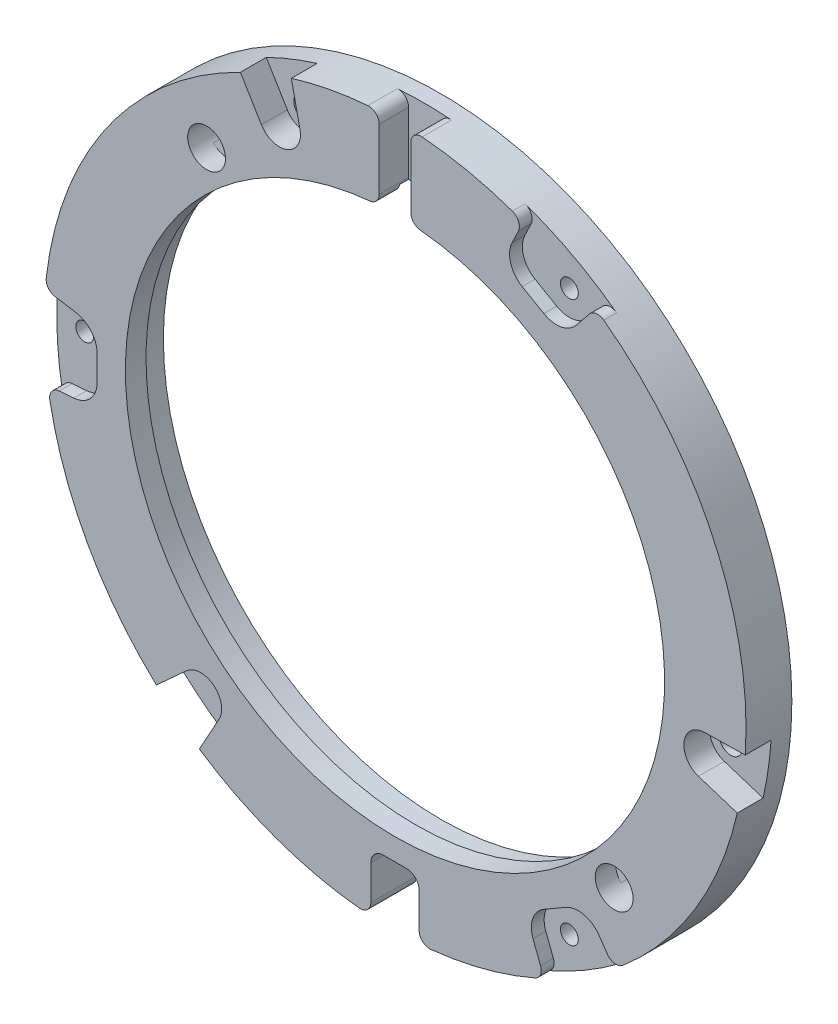
from build123d import *
from build123d.topology import SkipClean

# Parameters (mm, degrees)
CUT_EXTRUDE_1_DEPTH              = 3
SKETCH_3_R                       = 0.425
CUT_EXTRUDE_2_DEPTH              = 10
CUT_EXTRUDE_3_DEPTH              = 0.61
FILLET_1_R                       = 0.5
PATTERN_CIRCULAR_1_COUNT         = 3
FILLET_1_OF_PATTERN_CIRCULAR_1_R = 0.5
SKETCH_5_W                       = 1.5
SKETCH_5_H                       = 10.413141387
CUT_EXTRUDE_4_DEPTH              = 1.4
FILLET_2_R                       = 0.6
SKETCH_22_R                      = 0.9
CUT_EXTRUDE_14_DEPTH             = 24.697731959
FILLET_3_R                       = 0.5
SKETCH_14_R                      = 0.55
CUT_EXTRUDE_9_DEPTH              = 24.697731959
CUT_EXTRUDE_10_DEPTH             = 1.23
SKETCH_23_R                      = 13.2
SKETCH_23_R_2                    = 0.425
SKETCH_23_R_3                    = 0.9
SKETCH_23_R_4                    = 0.55
EXTRUDE_1_DEPTH                  = 0.23
CUT_EXTRUDE_15_DEPTH             = 1.2


with BuildPart() as part:
    # Эскиз1 → Повернуть1 (revolve)
    with BuildSketch(Plane(origin=(0, 0, 0), x_dir=(1, 0, 0), z_dir=(0, 1, 0)), mode=Mode.PRIVATE) as revolve_1_sk:
        Polygon((-16.7, 0), (-12.825, 0), (-12.825, 0.98), (-13.2, 0.98), (-13.2, 1.95), (-16.7, 1.95), align=None)
    revolve(revolve_1_sk.sketch.rotate(Axis((0, 0, 0), (0, 0, -1)), 180), axis=Axis((0, 0, 0), (0, 0, -1)))

    # Эскиз2 → Вырез-Вытянуть1 (cut)
    with BuildSketch(Plane(origin=(0, 0, -1.95), x_dir=(-1, 0, 0), z_dir=(0, 0, -1))):
        with BuildLine():
            Line((1.15, -16.660357139), (1.15, -13.86))
            Line((1.15, -13.86), (-1.15, -13.86))
            Line((-1.15, -13.86), (-1.15, -16.660357139))
            ThreePointArc((-1.15, -16.660357139), (0, -16.850858655), (1.15, -16.660357139))
        make_face()
    extrude(amount=-CUT_EXTRUDE_1_DEPTH, mode=Mode.SUBTRACT)

    # Эскиз3 → Вырез-Вытянуть2 (cut)
    with BuildSketch(Plane.XY):
        with Locations((-15.37, 0)):
            Circle(SKETCH_3_R)
    cut_extrude_2 = extrude(amount=-CUT_EXTRUDE_2_DEPTH, mode=Mode.SUBTRACT)

    # Эскиз4 → Вырез-Вытянуть3 (cut)
    with BuildSketch(Plane.XY):
        with BuildLine():
            Line((-15.183288241, 1.185390734), (-17.344587168, 1.525820031))
            Line((-17.344587168, 1.525820031), (-17.293113612, -0.525872079))
            Line((-17.293113612, -0.525872079), (-16.759364893, -2.507589098))
            Line((-16.759364893, -2.507589098), (-15.275238911, -2.391362418))
            ThreePointArc((-15.275238911, -2.391362418), (-14.487532806, -2.009361072), (-14.168928398, -1.193948803))
            Line((-14.168928398, -1.193948803), (-14.170000491, 0.001081813))
            ThreePointArc((-14.170000491, 0.001081813), (-14.458194682, 0.780140539), (-15.183288241, 1.185390734))
        make_face()
    cut_extrude_3 = extrude(amount=-CUT_EXTRUDE_3_DEPTH, mode=Mode.SUBTRACT)

    # Скругление1
    fillet_1_edges = [part.edges().sort_by_distance(p)[0] for p in [
        (-16.513575068, -2.488340506, -0.305),
        (-16.639959355, 1.414833093, -0.305),
    ]]
    fillet(fillet_1_edges, radius=FILLET_1_R)

    # Круговой массив1: Вырез-Вытянуть2, Вырез-Вытянуть3 ×3 about axis
    pattern_circular_1_axis = Axis((0, 0, 0), (0, 0, 1))
    add([cut_extrude_2.rotate(pattern_circular_1_axis, i * 360 / PATTERN_CIRCULAR_1_COUNT) for i in range(1, PATTERN_CIRCULAR_1_COUNT)], mode=Mode.SUBTRACT)
    add([cut_extrude_3.rotate(pattern_circular_1_axis, i * 360 / PATTERN_CIRCULAR_1_COUNT) for i in range(1, PATTERN_CIRCULAR_1_COUNT)], mode=Mode.SUBTRACT)

    # Скругление1 of Круговой массив1
    fillet_1_of_pattern_circular_1_edges = [part.edges().sort_by_distance(p)[0] for p in [
        (10.411753626, -13.057005263, -0.305),
        (7.094698277, -15.118044065, -0.305),
        (6.101821442, 15.545345769, -0.305),
        (9.545261078, 13.703210973, -0.305),
    ]]
    fillet(fillet_1_of_pattern_circular_1_edges, radius=FILLET_1_OF_PATTERN_CIRCULAR_1_R)

    # Эскиз5 → Вырез-Вытянуть4 (cut)
    with BuildSketch(Plane.XY):
        with Locations((0, 14.598970831)):
            Rectangle(SKETCH_5_W, SKETCH_5_H)
    extrude(amount=-CUT_EXTRUDE_4_DEPTH, mode=Mode.SUBTRACT)

    # Скругление2
    fillet_2_edges = [part.edges().sort_by_distance(p)[0] for p in [
        (1.15, -13.86, -0.975),
        (-1.15, -13.86, -0.975),
    ]]
    fillet(fillet_2_edges, radius=FILLET_2_R)

    # Эскиз22 → Вырез-Вытянуть14 (cut, through all)
    with BuildSketch(Plane(origin=(0, 0, -1.95), x_dir=(-1, 0, 0), z_dir=(0, 0, -1))):
        with Locations((-10.425450224, -9.714550304)):
            Circle(SKETCH_22_R)
        with Locations((8.963643503, 11.077707125)):
            Circle(SKETCH_22_R)
    extrude(amount=-CUT_EXTRUDE_14_DEPTH, mode=Mode.SUBTRACT)

    # Скругление3
    # the kernel refuses this fillet: 0.5 mm, written as the material it takes off along each edge
    with BuildSketch(Plane(origin=(-0.75, 12.803051394, 1.157971634), x_dir=(0, 1, 0), z_dir=(0, 0, -1))) as fillet_3_piece_1_section:
        with BuildLine():
            CenterArc((0.463188653, -0.5), FILLET_3_R, 90, 84.617246865)
            ThreePointArc((-0.03460647, -0.453095685), (-0.015296317, -0.226701126), (0, 0))
            Line((0, 0), (0.463188653, 0))
        make_face()
    fillet_3_piece_1 = extrude(amount=3.295943267, mode=Mode.PRIVATE)
    fillet_3_piece_1 = split(fillet_3_piece_1, bisect_by=Plane(origin=(-0.752336833, 13.200365704, -1.4), z_dir=(0, 0, 1)), keep=Keep.TOP, mode=Mode.PRIVATE)
    add(fillet_3_piece_1, mode=Mode.SUBTRACT)
    with BuildSketch(Plane(origin=(0.75, 12.803051394, 1.157971634), x_dir=(0.9970959124373047, -0.07615603325291273, 0), z_dir=(0, 0, -1))) as fillet_3_piece_2_section:
        with BuildLine():
            CenterArc((0.463273346, -0.49992153), FILLET_3_R, 91.015105015, 84.617246865)
            Line((-0.03527461, -0.461843513), (0, 0))
            ThreePointArc((0, 0), (0.227207673, -0.002012763), (0.454415347, 0))
        make_face()
    fillet_3_piece_2 = extrude(amount=3.295943267, mode=Mode.PRIVATE)
    fillet_3_piece_2 = split(fillet_3_piece_2, bisect_by=Plane(origin=(0.850744081, 12.897606018, -1.4), z_dir=(0, 0, 1)), keep=Keep.TOP, mode=Mode.PRIVATE)
    add(fillet_3_piece_2, mode=Mode.SUBTRACT)
    with BuildSketch(Plane(origin=(0.75, 16.683150182, -1.4), x_dir=(0.9981351186761567, -0.061043303198095235, 0), z_dir=(0, 0, 1))) as fillet_3_piece_3:
        with BuildLine():
            CenterArc((0.531508869, -0.499934747), FILLET_3_R, 89.074330097, 94.425369323)
            Line((0.03244131, -0.530456399), (0, 0))
            ThreePointArc((0, 0), (0.269793256, 0.002179436), (0.539586512, 0))
        make_face()
    extrude(amount=2.748966279, mode=Mode.SUBTRACT)
    with BuildSketch(Plane(origin=(-0.75, 16.683150182, -1.4), x_dir=(-0.9981351186761567, -0.06104330319809576, 0), z_dir=(0, 0, 1))) as fillet_3_piece_4:
        with BuildLine():
            CenterArc((0.531508869, 0.499934747), FILLET_3_R, 176.500300581, 94.425369323)
            Line((0.03244131, 0.530456399), (0, 0))
            ThreePointArc((0, 0), (0.269793256, -0.002179436), (0.539586512, 0))
        make_face()
    extrude(amount=2.748966279, mode=Mode.SUBTRACT)
    with BuildSketch(Plane(origin=(-1.15, -16.660357139, -3.33236123), x_dir=(-0.9963494237820577, 0.08536876319334569, 0), z_dir=(0, 0, 1))) as fillet_3_piece_5:
        with BuildLine():
            CenterArc((0.54466688, -0.499931476), FILLET_3_R, 89.051412184, 95.845818339)
            Line((0.046492168, -0.542615858), (0, 0))
            ThreePointArc((0, 0), (0.276472246, 0.002288687), (0.552944492, 0))
        make_face()
    extrude(amount=4.71472246, mode=Mode.SUBTRACT)
    with BuildSketch(Plane(origin=(1.15, -16.660357139, -3.33236123), x_dir=(0, 1, 0), z_dir=(0, 0, 1))) as fillet_3_piece_6:
        with BuildLine():
            CenterArc((0.544603976, -0.5), FILLET_3_R, 90, 95.845818339)
            ThreePointArc((0.047204187, -0.550925926), (0.021321762, -0.275658345), (0, 0))
            Line((0, 0), (0.544603976, 0))
        make_face()
    extrude(amount=4.71472246, mode=Mode.SUBTRACT)

    # Эскиз14 → Вырез-Вытянуть9 (cut, through all)
    with BuildSketch(Plane.XY):
        with Locations((-5.497143352, 13.848877751)):
            Circle(SKETCH_14_R)
        with Locations((-9.24490827, -11.685104667)):
            Circle(SKETCH_14_R)
        with Locations((14.742051622, -2.163773084)):
            Circle(SKETCH_14_R)
    extrude(amount=-CUT_EXTRUDE_9_DEPTH, mode=Mode.SUBTRACT)

    # Эскиз15 → Вырез-Вытянуть10 (cut)
    with BuildSketch(Plane.XY):
        with BuildLine():
            Line((-7.888402349, 15.883675138), (-5.15235159, 16.969717163))
            Line((-5.15235159, 16.969717163), (-4.519975471, 14.06134641))
            ThreePointArc((-4.519975471, 14.06134641), (-5.128207557, 12.919422868), (-6.354014422, 13.333346986))
            Line((-6.354014422, 13.333346986), (-7.888402349, 15.883675138))
        make_face()
        with BuildLine():
            Line((17.699867349, -1.110280739), (17.272381953, -4.022791215))
            Line((17.272381953, -4.022791215), (14.437470938, -3.116259623))
            ThreePointArc((14.437470938, -3.116259623), (13.752652185, -2.018553414), (14.724024418, -1.163935587))
            Line((14.724024418, -1.163935587), (17.699867349, -1.110280739))
        make_face()
        with BuildLine():
            Line((-9.811465, -14.773394399), (-12.120030363, -12.946925948))
            Line((-12.120030363, -12.946925948), (-9.917495467, -10.945086787))
            ThreePointArc((-9.917495467, -10.945086787), (-8.624444628, -10.900869454), (-8.370009996, -12.169411398))
            Line((-8.370009996, -12.169411398), (-9.811465, -14.773394399))
        make_face()
    extrude(amount=-CUT_EXTRUDE_10_DEPTH, mode=Mode.SUBTRACT)

    # Эскиз23 → Бобышка-Вытянуть1 (add)
    with SkipClean():  # the faces are left unmerged after this step: merging them gives an invalid solid
        with BuildSketch(Plane(origin=(0, 0, -1.95), x_dir=(-1, 0, 0), z_dir=(0, 0, -1))):
            with BuildLine():
                Line((1.15, -14.46), (1.15, -16.115753163))
                ThreePointArc((1.15, -16.115753163), (1.314935053, -16.486875085), (1.700925926, -16.613152952))
                ThreePointArc((1.700925926, -16.613152952), (0, 16.7), (-1.700925926, -16.613152952))
                ThreePointArc((-1.700925926, -16.613152952), (-1.314935053, -16.486875085), (-1.15, -16.115753163))
                Line((-1.15, -16.115753163), (-1.15, -14.46))
                ThreePointArc((-1.15, -14.46), (-0.974264069, -14.035735931), (-0.55, -13.86))
                Line((-0.55, -13.86), (0.55, -13.86))
                ThreePointArc((0.55, -13.86), (0.974264069, -14.035735931), (1.15, -14.46))
            make_face()
            with Locations(Location((0, 0, 0), (0, 0, 93.291137806))):
                Circle(SKETCH_23_R, mode=Mode.SUBTRACT)
            with Locations(Location((15.37, 0, 0), (0, 0, 180))):
                Circle(SKETCH_23_R_2, mode=Mode.SUBTRACT)
            with Locations(Location((-7.685, -13.310810456, 0), (0, 0, 180))):
                Circle(SKETCH_23_R_2, mode=Mode.SUBTRACT)
            with Locations(Location((-7.685, 13.310810456, 0), (0, 0, 180))):
                Circle(SKETCH_23_R_2, mode=Mode.SUBTRACT)
            with Locations((8.963643503, 11.077707125)):
                Circle(SKETCH_23_R_3, mode=Mode.SUBTRACT)
            with Locations((-10.425450224, -9.714550304)):
                Circle(SKETCH_23_R_3, mode=Mode.SUBTRACT)
            with Locations(Location((-14.742051622, -2.163773084, 0), (0, 0, 180))):
                Circle(SKETCH_23_R_4, mode=Mode.SUBTRACT)
            with Locations(Location((9.24490827, -11.685104667, 0), (0, 0, 180))):
                Circle(SKETCH_23_R_4, mode=Mode.SUBTRACT)
            with Locations(Location((5.497143352, 13.848877751, 0), (0, 0, 180))):
                Circle(SKETCH_23_R_4, mode=Mode.SUBTRACT)
        extrude(amount=EXTRUDE_1_DEPTH)

    # Эскиз24 → Вырез-Вытянуть15 (cut)
    with SkipClean():  # the faces are left unmerged after this step: merging them gives an invalid solid
        with BuildSketch(Plane(origin=(0, 0, -2.18), x_dir=(-1, 0, 0), z_dir=(0, 0, -1))):
            with BuildLine():
                Line((-9.767231893, -10.328348828), (9.621861835, 10.463908601))
                ThreePointArc((9.621861835, 10.463908601), (9.577442027, 11.735925456), (8.305425172, 11.691505649))
                Line((8.305425172, 11.691505649), (-11.083668556, -9.10075178))
                ThreePointArc((-11.083668556, -9.10075178), (-11.039248749, -10.372768636), (-9.767231893, -10.328348828))
            make_face()
        extrude(amount=-CUT_EXTRUDE_15_DEPTH, mode=Mode.SUBTRACT)


solid = part.part
